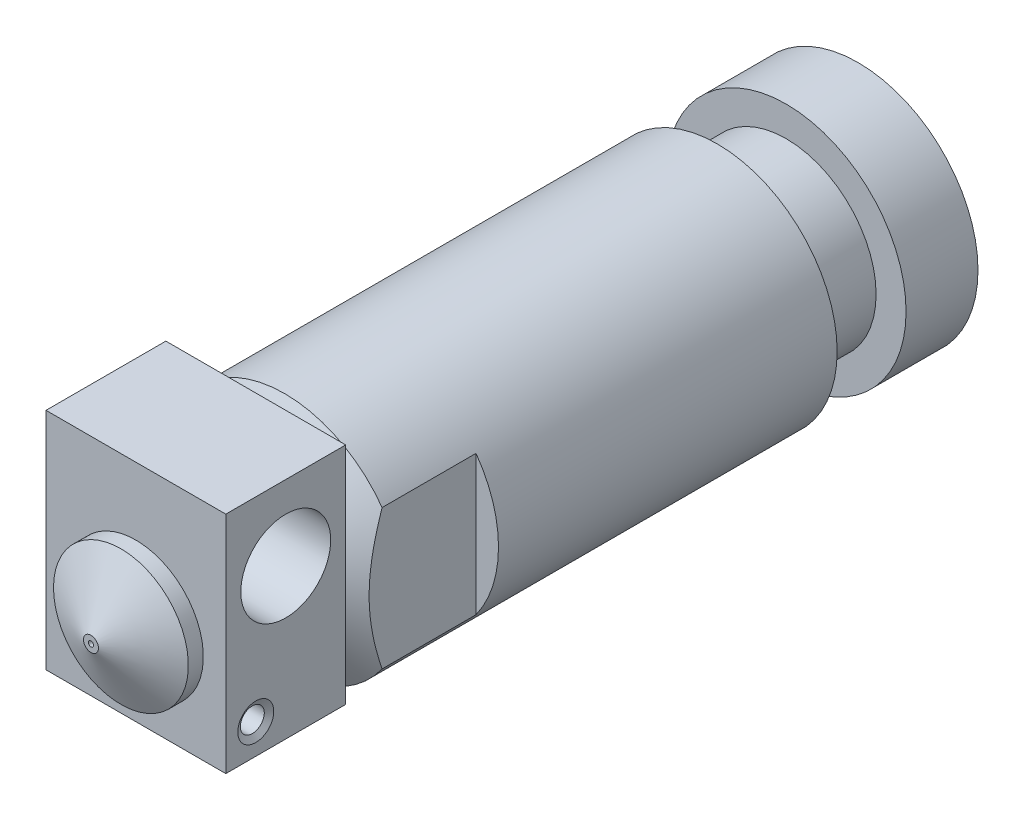
from build123d import *

# Parameters (mm, degrees)
ESQUISSE1_R             = 8
BOSS_EXTRU_1_DEPTH      = 40
ENL_V_START             = -4.8
ESQUISSE2_R             = 8
ESQUISSE2_R_2           = 6
ENL_V_MAT_EXTRU_1_DEPTH = 4.6
CHANFREIN1_SIZE         = 3
CHANFREIN1_SIZE2        = 1.732050808
ESQUISSE3_W             = 2
ESQUISSE3_H             = 12
ENL_V_MAT_EXTRU_2_DEPTH = 8
ESQUISSE4_R             = 1
ESQUISSE8_R             = 1
ENL_V_MAT_EXTRU_4_DEPTH = 42.569219382
ESQUISSE9_R             = 4
BOSS_EXTRU_2_DEPTH      = 0.2
ESQUISSE10_W            = 12
ESQUISSE10_H            = 15
BOSS_EXTRU_3_DEPTH      = 8
ESQUISSE11_R            = 3
ENL_V_MAT_EXTRU_5_DEPTH = 51.992548475
ESQUISSE13_R            = 0.8
ENL_V_MAT_EXTRU_6_DEPTH = 3
CHANFREIN2_SIZE         = 0.4
CHANFREIN2_SIZE2        = 0.230940108
ESQUISSE14_R            = 4.5
BOSS_EXTRU_4_DEPTH      = 1
ESQUISSE15_R            = 4.5
BOSS_EXTRU_5_DEPTH      = 2
CHANFREIN3_SIZE         = 2
CHANFREIN3_SIZE2        = 4
ESQUISSE16_R            = 0.175
ENL_V_MAT_EXTRU_7_DEPTH = 53.596958087


with BuildPart() as part:
    # Esquisse1 → Boss.-Extru.1 (new body)
    with BuildSketch(Plane.XY):
        Circle(ESQUISSE1_R)
    extrude(amount=BOSS_EXTRU_1_DEPTH)

    # Esquisse2 → Enlèv. mat.-Extru.1 (cut)
    with BuildSketch(Plane(origin=(0, 0, 0), x_dir=(-1, 0, 0), z_dir=(0, 0, -1)).offset(ENL_V_START)):
        Circle(ESQUISSE2_R)
        Circle(ESQUISSE2_R_2, mode=Mode.SUBTRACT)
    extrude(amount=-ENL_V_MAT_EXTRU_1_DEPTH, mode=Mode.SUBTRACT)

    # Chanfrein1
    chanfrein1_edges = [part.edges().sort_by_distance(p)[0] for p in [
        (-8, 0, 40),
    ]]
    chanfrein1_side = [part.faces().sort_by_distance(p)[0] for p in [
        (0, 0, 40),
    ]]
    chamfer(chanfrein1_edges, length=CHANFREIN1_SIZE, length2=CHANFREIN1_SIZE2, reference=chanfrein1_side[0])

    # Esquisse3 → Enlèv. mat.-Extru.2 (cut)
    with BuildSketch(Plane.XY.offset(40)):
        with Locations((-7.5, 0)):
            Rectangle(ESQUISSE3_W, ESQUISSE3_H)
        with Locations((7.5, 0)):
            Rectangle(ESQUISSE3_W, ESQUISSE3_H)
    extrude(amount=-ENL_V_MAT_EXTRU_2_DEPTH, mode=Mode.SUBTRACT)

    # Esquisse4 → Enlèvement de matière-Révolution1 (revolve, cut)
    with BuildSketch(Plane(origin=(0, 0, 0), x_dir=(1, 0, 0), z_dir=(0, 1, 0))):
        with Locations((-5, -26.5)):
            Circle(ESQUISSE4_R)
        with Locations((-5, -23.5)):
            Circle(ESQUISSE4_R)
        with Locations((-5, -20.5)):
            Circle(ESQUISSE4_R)
        with Locations((-5, -17.5)):
            Circle(ESQUISSE4_R)
        with Locations((-5, -14.5)):
            Circle(ESQUISSE4_R)
    revolve(axis=Axis((0, 0, -7.180896648), (0, 0, 1)), mode=Mode.SUBTRACT)

    # Esquisse8 → Enlèv. mat.-Extru.4 (cut, through all)
    with BuildSketch(Plane(origin=(0, 0, 0), x_dir=(-1, 0, 0), z_dir=(0, 0, -1))):
        Circle(ESQUISSE8_R)
    extrude(amount=-ENL_V_MAT_EXTRU_4_DEPTH, mode=Mode.SUBTRACT)

    # Esquisse9 → Boss.-Extru.2 (add)
    with BuildSketch(Plane.XY.offset(40)):
        Circle(ESQUISSE9_R)
    extrude(amount=BOSS_EXTRU_2_DEPTH)

    # Esquisse10 → Boss.-Extru.3 (add)
    with BuildSketch(Plane.XY.offset(40.2)):
        with Locations((0, 1.5)):
            Rectangle(ESQUISSE10_W, ESQUISSE10_H)
    extrude(amount=BOSS_EXTRU_3_DEPTH)

    # Esquisse11 → Enlèv. mat.-Extru.5 (cut, through all)
    with BuildSketch(Plane(origin=(6, 0, 0), x_dir=(0, 0, -1), z_dir=(1, 0, 0))):
        with Locations((-44.2, 4)):
            Circle(ESQUISSE11_R)
    extrude(amount=-ENL_V_MAT_EXTRU_5_DEPTH, mode=Mode.SUBTRACT)

    # Esquisse13 → Enlèv. mat.-Extru.6 (cut)
    with BuildSketch(Plane(origin=(6, 0, 0), x_dir=(0, 0, -1), z_dir=(1, 0, 0))):
        with Locations((-46.2, -4)):
            Circle(ESQUISSE13_R)
    extrude(amount=-ENL_V_MAT_EXTRU_6_DEPTH, mode=Mode.SUBTRACT)

    # Chanfrein2
    chanfrein2_edges = [part.edges().sort_by_distance(p)[0] for p in [
        (6, -4, 47),
    ]]
    chanfrein2_side = [part.faces().sort_by_distance(p)[0] for p in [
        (6, 0.835368696, 44.155177657),
    ]]
    chamfer(chanfrein2_edges, length=CHANFREIN2_SIZE, length2=CHANFREIN2_SIZE2, reference=chanfrein2_side[0])

    # Esquisse14 → Boss.-Extru.4 (add)
    with BuildSketch(Plane.XY.offset(48.2)):
        Circle(ESQUISSE14_R)
    extrude(amount=BOSS_EXTRU_4_DEPTH)

    # Esquisse15 → Boss.-Extru.5 (add)
    with BuildSketch(Plane.XY.offset(49.2)):
        Circle(ESQUISSE15_R)
    extrude(amount=BOSS_EXTRU_5_DEPTH)

    # Chanfrein3
    chanfrein3_edges = [part.edges().sort_by_distance(p)[0] for p in [
        (-4.5, 0, 51.2),
    ]]
    chanfrein3_side = [part.faces().sort_by_distance(p)[0] for p in [
        (-4.5, 0, 49.7),
    ]]
    chamfer(chanfrein3_edges, length=CHANFREIN3_SIZE, length2=CHANFREIN3_SIZE2, reference=chanfrein3_side[0])

    # Esquisse16 → Enlèv. mat.-Extru.7 (cut, through all)
    with BuildSketch(Plane.XY.offset(51.2)):
        Circle(ESQUISSE16_R)
    extrude(amount=-ENL_V_MAT_EXTRU_7_DEPTH, mode=Mode.SUBTRACT)


solid = part.part
